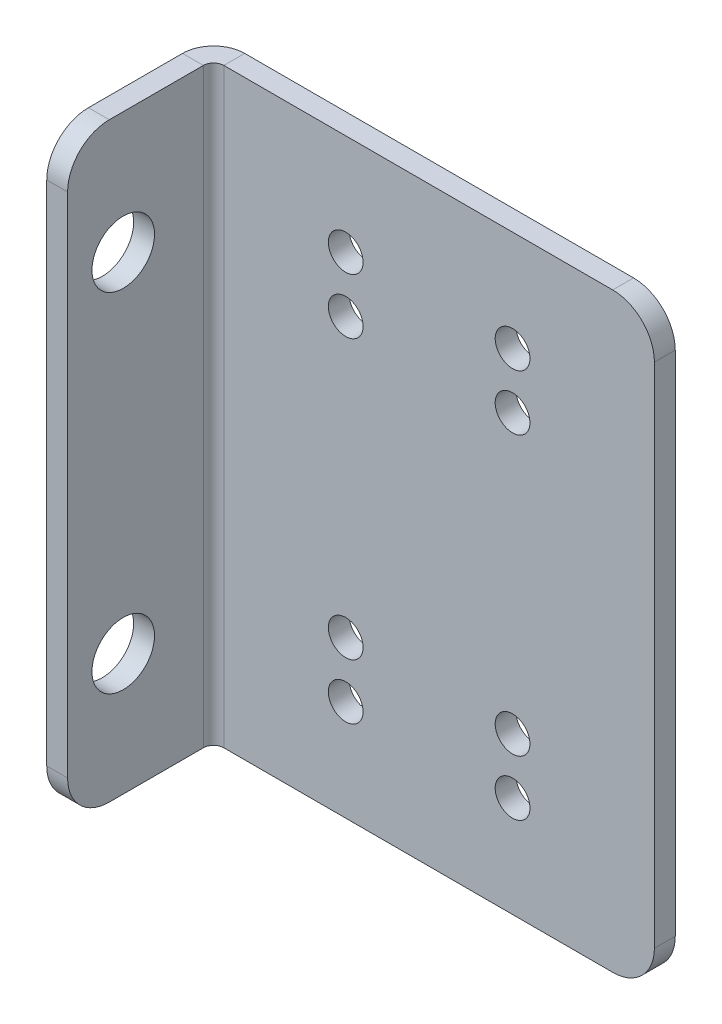
from build123d import *

# Parameters (mm, degrees)
SKETCH_1_W                       = 33.2
SKETCH_1_H                       = 42.5
SM_BASE_FLANGE_1_DEPTH           = 1.5
SM_EDGE_FLANGE_1_STRIP_W         = 7.4732
SM_EDGE_FLANGE_1_STRIP_H         = 1.5
SM_EDGE_FLANGE_1_STRIP_CUT_DEPTH = 42.5
SM_EDGE_FLANGE_1_DEPTH           = 42.5
SKETCH_9_R                       = 1.25
CUT_EXTRUDE_1_DEPTH              = 10
SKETCH_10_R                      = 2.25
CUT_EXTRUDE_2_DEPTH              = 10
FILLET_1_R                       = 3


# Sheet-metal steps are written as plain solids
with BuildPart() as part:
    # Sketch 1 → 基体-法兰1 (new body)
    with BuildSketch(Plane.XY):
        Rectangle(SKETCH_1_W, SKETCH_1_H)
    extrude(amount=-SM_BASE_FLANGE_1_DEPTH)

    # 边线-法兰1 strip (across the edge) → 边线-法兰1 strip cut (cut)
    with BuildSketch(Plane(origin=(-16.6, 21.25, 0), x_dir=(1, 0, 0), z_dir=(0, -1, 0))):
        with Locations((-1.5, -0.75)):
            Rectangle(SM_EDGE_FLANGE_1_STRIP_W, SM_EDGE_FLANGE_1_STRIP_H)
    extrude(amount=SM_EDGE_FLANGE_1_STRIP_CUT_DEPTH, mode=Mode.SUBTRACT)

    # 边线-法兰1 section (across the edge) → 边线-法兰1 (add)
    with BuildSketch(Plane(origin=(-16.6, 21.25, 0), x_dir=(1, 0, 0), z_dir=(0, -1, 0))):
        with BuildLine():
            Line((0, 0.7366), (0, 10.5))
            Line((0, 10.5), (1.5, 10.5))
            Line((1.5, 10.5), (1.5, 0.7366))
            ThreePointArc((1.5, 0.7366), (1.715745145, 0.215745145), (2.2366, 0))
            Line((2.2366, 0), (2.2366, -1.5))
            ThreePointArc((2.2366, -1.5), (0.655084973, -0.844915027), (0, 0.7366))
        make_face()
    extrude(amount=SM_EDGE_FLANGE_1_DEPTH)

    # 草图9 → 切除-拉伸1 (cut)
    with BuildSketch(Plane.XY):
        with Locations((6.4, 14)):
            Circle(SKETCH_9_R)
        with Locations((-5.6, 14)):
            Circle(SKETCH_9_R)
        with Locations((6.4, -10)):
            Circle(SKETCH_9_R)
        with Locations((-5.6, -10)):
            Circle(SKETCH_9_R)
    cut_extrude_1 = extrude(amount=-CUT_EXTRUDE_1_DEPTH, mode=Mode.SUBTRACT)

    # 草图10 → 切除-拉伸2 (cut)
    with BuildSketch(Plane(origin=(-15.1, 0, 0), x_dir=(0, 0, -1), z_dir=(1, 0, 0))):
        with Locations((-6.5, 12.5)):
            Circle(SKETCH_10_R)
        with Locations((-6.5, -12.5)):
            Circle(SKETCH_10_R)
    extrude(amount=-CUT_EXTRUDE_2_DEPTH, mode=Mode.SUBTRACT)

    # 镜向1: 切除-拉伸1 across plane
    add(cut_extrude_1.mirror(Plane.ZX), mode=Mode.SUBTRACT)

    # 圆角1
    fillet_1_edges = [part.edges().sort_by_distance(p)[0] for p in [
        (-15.85, 21.25, 10.5),
        (-15.85, -21.25, 10.5),
        (16.6, 21.25, -0.75),
        (16.6, -21.25, -0.75),
    ]]
    fillet(fillet_1_edges, radius=FILLET_1_R)


solid = part.part
